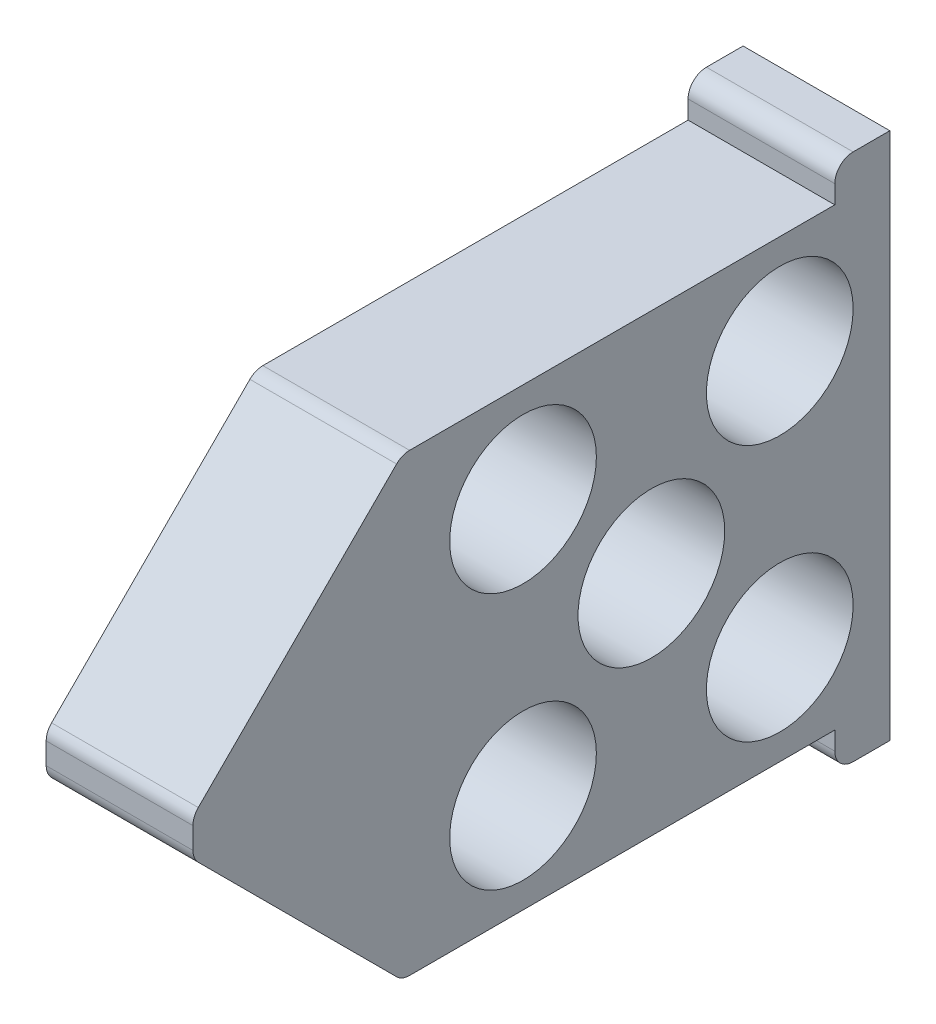
from build123d import *

# Parameters (mm, degrees)
BOSS_EXTRUDE1_DEPTH                = 4
FILLET2_R                          = 0.5
F_4_0MM_MASS_REDUCTION_HOLES_D     = 4
F_4_0MM_MASS_REDUCTION_HOLES_DEPTH = 9.525
F_4_0MM_MASS_REDUCTION_HOLES_TIP   = 1.201721238


with BuildPart() as part:
    # Sketch1 → Boss-Extrude1 (new body)
    with BuildSketch(Plane(origin=(0, 0, 0), x_dir=(0, 0, -1), z_dir=(1, 0, 0))):
        Polygon((-5.8, 6.2), (-11.5, 0.5), (-11.5, -0.5), (-5.8, -6.2), (6, -6.2), (6, -7.2), (7.5, -7.2), (7.5, 7.2), (6, 7.2), (6, 6.2), align=None)
    extrude(amount=BOSS_EXTRUDE1_DEPTH)

    # Fillet2
    fillet2_edges = [part.edges().sort_by_distance(p)[0] for p in [
        (2, -7.2, -6),
        (2, 7.2, -6),
        (2, -6.2, 5.8),
        (2, -0.5, 11.5),
        (2, 0.5, 11.5),
        (2, 6.2, 5.8),
    ]]
    fillet(fillet2_edges, radius=FILLET2_R)

    # Ø4.0mm mass reduction holes
    with Locations(Plane(origin=(4, 0, 0), x_dir=(0, 0, -1), z_dir=(1, 0, 0))):
        with Locations((4.5, -3.5), (4.5, 3.5), (-2.5, -3.5), (-2.5, 3.5), (1, 0)):
            Hole(F_4_0MM_MASS_REDUCTION_HOLES_D / 2, depth=F_4_0MM_MASS_REDUCTION_HOLES_DEPTH)
            with Locations((0, 0, -(F_4_0MM_MASS_REDUCTION_HOLES_DEPTH + F_4_0MM_MASS_REDUCTION_HOLES_TIP / 2))):  # 118° drill point
                Cone(0, F_4_0MM_MASS_REDUCTION_HOLES_D / 2, F_4_0MM_MASS_REDUCTION_HOLES_TIP, mode=Mode.SUBTRACT)


solid = part.part
